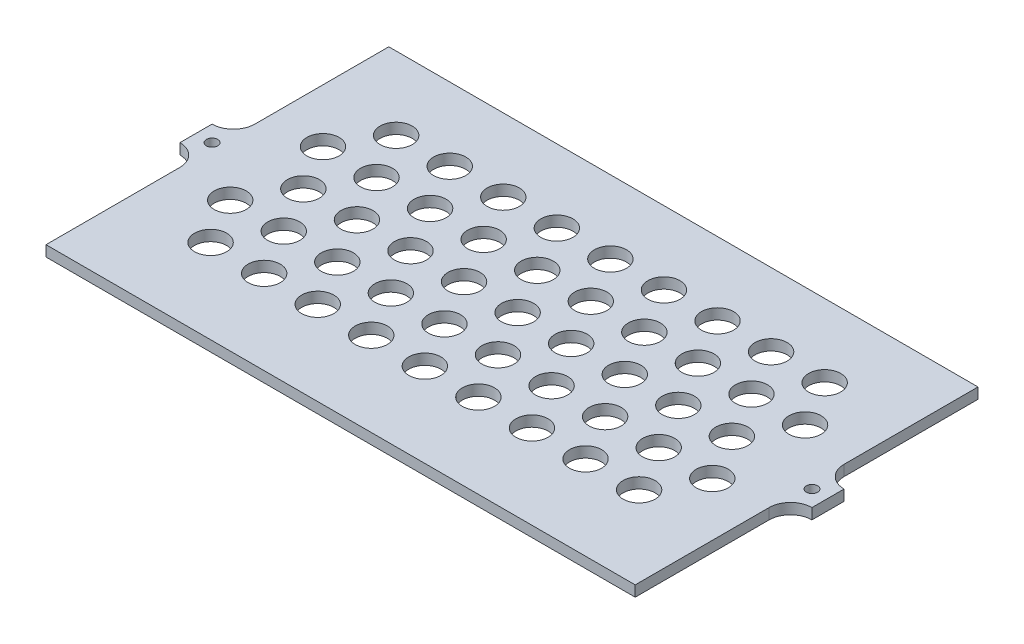
from build123d import *

# Parameters (mm, degrees)
SKETCH_1_R          = 1.05
EXTRUDE_1_DEPTH     = 2
SKETCH_2_R          = 3
CUT_EXTRUDE_1_DEPTH = 2
OTHER_1_OUTLINE_R   = 3
OTHER_1_DEPTH       = 2
FILLET_1_R          = 4


# Read off the part's stored shape, not the designer's step: 填充阵列1
with BuildPart() as part:
    # 草图1 → 凸台-拉伸1 (new body)
    with BuildSketch(Plane(origin=(0, 0, 0), x_dir=(1, 0, 0), z_dir=(0, 1, 0))):
        Polygon((110, 35), (110, 64), (0, 64), (0, 35), (-4, 35), (-4, 29), (0, 29), (0, 0), (110, 0), (110, 29), (114, 29), (114, 35), align=None)
        with Locations(Location((-1, 32, 0), (0, 0, 270))):
            Circle(SKETCH_1_R, mode=Mode.SUBTRACT)
        with Locations(Location((111, 32, 0), (0, 0, 270))):
            Circle(SKETCH_1_R, mode=Mode.SUBTRACT)
    extrude(amount=EXTRUDE_1_DEPTH)

    # 草图2 → 切除-拉伸1 (cut)
    with BuildSketch(Plane(origin=(0, 2, 0), x_dir=(1, 0, 0), z_dir=(0, 1, 0))):
        with Locations(Location((55, 33.05, 0), (0, 0, 270))):
            Circle(SKETCH_2_R)
    extrude(amount=-CUT_EXTRUDE_1_DEPTH, mode=Mode.SUBTRACT)

    # 填充阵列1 outline → 填充阵列1 (cut)
    with BuildSketch(Plane(origin=(0, 0, 0), x_dir=(1, 0, 0), z_dir=(0, 1, 0))):
        with Locations((10, 41.710254038)):
            Circle(OTHER_1_OUTLINE_R)
        with Locations((85, 33.05)):
            Circle(OTHER_1_OUTLINE_R)
        with Locations((90, 41.710254038)):
            Circle(OTHER_1_OUTLINE_R)
        with Locations((95, 50.370508076)):
            Circle(OTHER_1_OUTLINE_R)
        with Locations((85, 15.729491924)):
            Circle(OTHER_1_OUTLINE_R)
        with Locations((80, 24.389745962)):
            Circle(OTHER_1_OUTLINE_R)
        with Locations((75, 15.729491924)):
            Circle(OTHER_1_OUTLINE_R)
        with Locations((85, 50.370508076)):
            Circle(OTHER_1_OUTLINE_R)
        with Locations((80, 41.710254038)):
            Circle(OTHER_1_OUTLINE_R)
        with Locations((100, 24.389745962)):
            Circle(OTHER_1_OUTLINE_R)
        with Locations((90, 24.389745962)):
            Circle(OTHER_1_OUTLINE_R)
        with Locations((95, 33.05)):
            Circle(OTHER_1_OUTLINE_R)
        with Locations((100, 41.710254038)):
            Circle(OTHER_1_OUTLINE_R)
        with Locations((95, 15.729491924)):
            Circle(OTHER_1_OUTLINE_R)
        with Locations((30, 41.710254038)):
            Circle(OTHER_1_OUTLINE_R)
        with Locations((35, 50.370508076)):
            Circle(OTHER_1_OUTLINE_R)
        with Locations((25, 15.729491924)):
            Circle(OTHER_1_OUTLINE_R)
        with Locations((30, 24.389745962)):
            Circle(OTHER_1_OUTLINE_R)
        with Locations((35, 15.729491924)):
            Circle(OTHER_1_OUTLINE_R)
        with Locations((45, 50.370508076)):
            Circle(OTHER_1_OUTLINE_R)
        with Locations((40, 41.710254038)):
            Circle(OTHER_1_OUTLINE_R)
        with Locations((35, 33.05)):
            Circle(OTHER_1_OUTLINE_R)
        with Locations((20, 41.710254038)):
            Circle(OTHER_1_OUTLINE_R)
        with Locations((15, 33.05)):
            Circle(OTHER_1_OUTLINE_R)
        with Locations((10, 24.389745962)):
            Circle(OTHER_1_OUTLINE_R)
        with Locations((15, 50.370508076)):
            Circle(OTHER_1_OUTLINE_R)
        with Locations((25, 33.05)):
            Circle(OTHER_1_OUTLINE_R)
        with Locations((20, 24.389745962)):
            Circle(OTHER_1_OUTLINE_R)
        with Locations((15, 15.729491924)):
            Circle(OTHER_1_OUTLINE_R)
        with Locations((25, 50.370508076)):
            Circle(OTHER_1_OUTLINE_R)
        with Locations((55, 15.729491924)):
            Circle(OTHER_1_OUTLINE_R)
        with Locations((60, 24.389745962)):
            Circle(OTHER_1_OUTLINE_R)
        with Locations((65, 33.05)):
            Circle(OTHER_1_OUTLINE_R)
        with Locations((70, 41.710254038)):
            Circle(OTHER_1_OUTLINE_R)
        with Locations((75, 33.05)):
            Circle(OTHER_1_OUTLINE_R)
        with Locations((70, 24.389745962)):
            Circle(OTHER_1_OUTLINE_R)
        with Locations((65, 15.729491924)):
            Circle(OTHER_1_OUTLINE_R)
        with Locations((75, 50.370508076)):
            Circle(OTHER_1_OUTLINE_R)
        with Locations((40, 24.389745962)):
            Circle(OTHER_1_OUTLINE_R)
        with Locations((45, 33.05)):
            Circle(OTHER_1_OUTLINE_R)
        with Locations((50, 41.710254038)):
            Circle(OTHER_1_OUTLINE_R)
        with Locations((55, 50.370508076)):
            Circle(OTHER_1_OUTLINE_R)
        with Locations((45, 15.729491924)):
            Circle(OTHER_1_OUTLINE_R)
        with Locations((50, 24.389745962)):
            Circle(OTHER_1_OUTLINE_R)
        with Locations((60, 41.710254038)):
            Circle(OTHER_1_OUTLINE_R)
        with Locations((65, 50.370508076)):
            Circle(OTHER_1_OUTLINE_R)
    extrude(amount=OTHER_1_DEPTH, mode=Mode.SUBTRACT)

    # 圆角1
    fillet_1_edges = [part.edges().sort_by_distance(p)[0] for p in [
        (110, 1, -29),
        (110, 1, -35),
        (0, 1, -35),
        (0, 1, -29),
    ]]
    fillet(fillet_1_edges, radius=FILLET_1_R - 0.0001)  # a hair under: the kernel refuses the full size


solid = part.part
